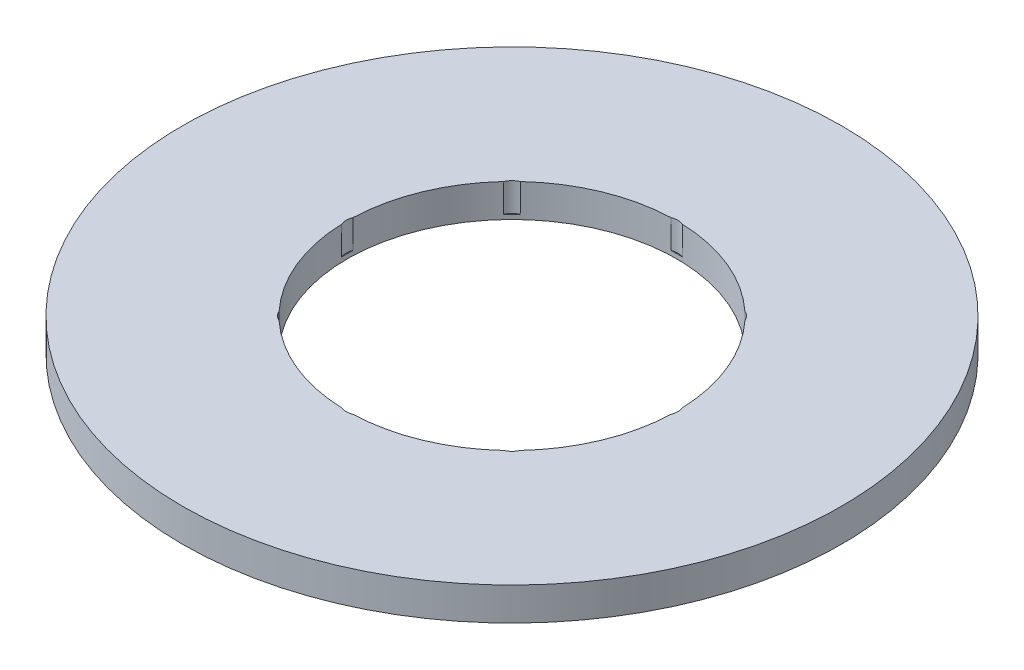
from build123d import *

# Parameters (mm, degrees)
SKETCH1_R           = 100
BOSS_EXTRUDE1_DEPTH = 10
SKETCH2_R           = 50
CUT_EXTRUDE1_DEPTH  = 142.774468788
SKETCH3_R           = 4.922074395
CUT_EXTRUDE2_DEPTH  = 8.62692327
CIRPATTERN1_COUNT   = 8


with BuildPart() as part:
    # Sketch1 → Boss-Extrude1 (new body)
    with BuildSketch(Plane(origin=(0, 0, 0), x_dir=(1, 0, 0), z_dir=(0, 1, 0))):
        Circle(SKETCH1_R)
    extrude(amount=BOSS_EXTRUDE1_DEPTH)

    # Sketch2 → Cut-Extrude1 (cut, through all)
    with BuildSketch(Plane(origin=(0, 0, 0), x_dir=(1, 0, 0), z_dir=(0, 1, 0))):
        Circle(SKETCH2_R)
    extrude(amount=CUT_EXTRUDE1_DEPTH, mode=Mode.SUBTRACT)

    # Sketch3 → Cut-Extrude2 (cut)
    with BuildSketch(Plane(origin=(0, 10, 0), x_dir=(1, 0, 0), z_dir=(0, 1, 0))):
        with Locations((-45.384931855, 0)):
            Circle(SKETCH3_R)
    cut_extrude2 = extrude(amount=-CUT_EXTRUDE2_DEPTH, mode=Mode.SUBTRACT)

    # CirPattern1: Cut-Extrude2 ×8 about axis
    cirpattern1_axis = Axis((0, 0, 0), (0, 1, 0))
    for i in range(1, CIRPATTERN1_COUNT):
        add(cut_extrude2.rotate(cirpattern1_axis, i * 360 / CIRPATTERN1_COUNT), mode=Mode.SUBTRACT)


solid = part.part
